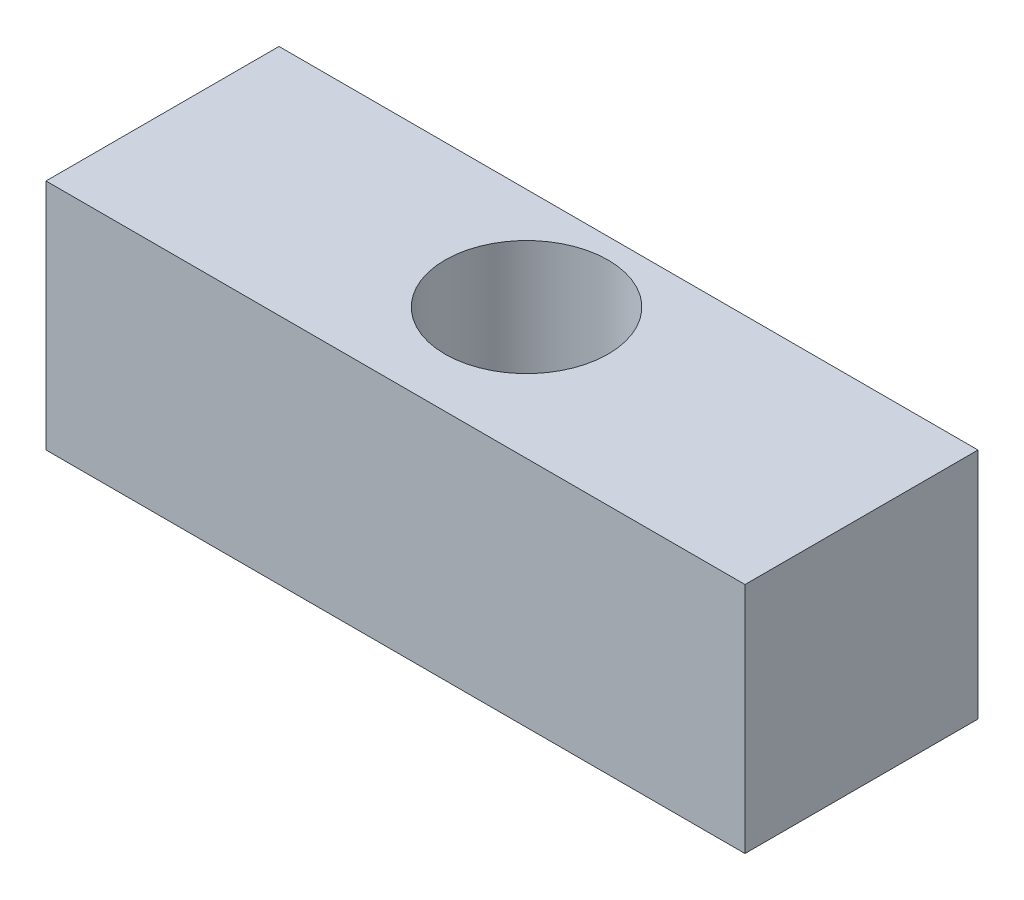
from build123d import *

# Parameters (mm, degrees)
SKETCH1_W           = 38.1
SKETCH1_H           = 12.7
SKETCH1_R           = 4.445
BOSS_EXTRUDE1_DEPTH = 12.7


with BuildPart() as part:
    # Sketch1 → Boss-Extrude1 (new body)
    with BuildSketch(Plane(origin=(0, 0, 0), x_dir=(1, 0, 0), z_dir=(0, 1, 0))):
        with Locations((19.05, 6.35)):
            Rectangle(SKETCH1_W, SKETCH1_H)
        with Locations((19.05, 7.14375)):
            Circle(SKETCH1_R, mode=Mode.SUBTRACT)
    extrude(amount=BOSS_EXTRUDE1_DEPTH)


solid = part.part
